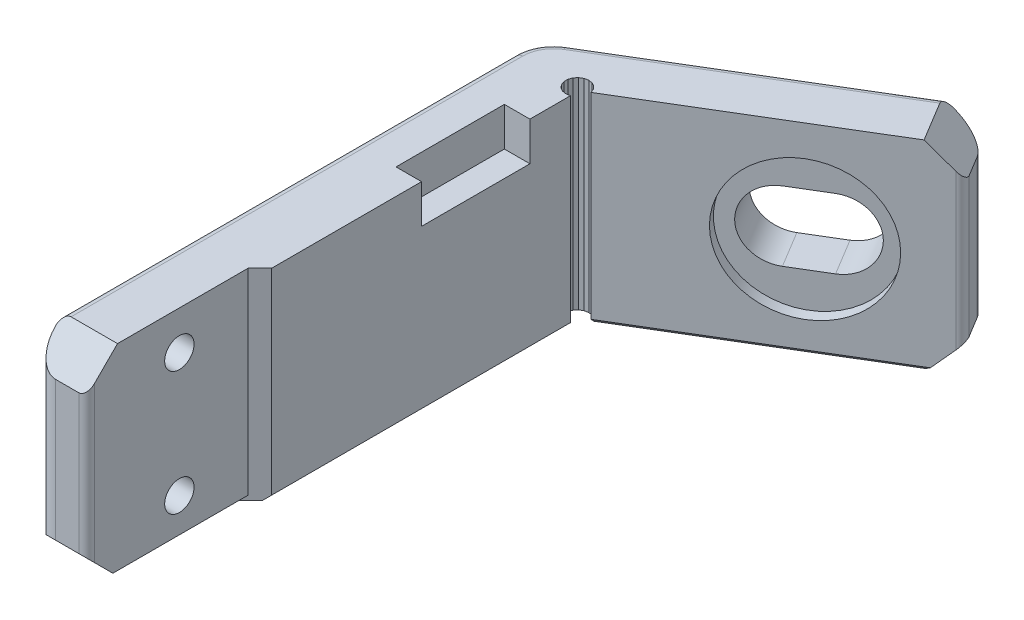
from build123d import *

# Parameters (mm, degrees)
LEG_AND_PAD_DEPTH          = 13
SCREW_HEAD_RELIEF_SKETCH_W = 14
SCREW_HEAD_RELIEF_SKETCH_H = 6
SCREW_HEAD_RELIEF_DEPTH    = 2.35
M6_SLOT_MIDDLE_DEPTH       = 4.5
SCREW_HOLES_SKETCH_R       = 1.9
SCREW_HOLES_DEPTH          = 4.5
LEG_TOP_CORNERS_SIZE       = 4
PAD_END_CORNERS_SIZE       = 4
OUTSIDE_OF_THE_BEND_R      = 5
LEG_TOP_OUTER_EDGE_R       = 3
PAD_END_OUTER_EDGE_R       = 3
LEG_TOP_INNER_EDGE_R       = 1
PAD_END_INNER_EDGE_R       = 1
BED_FACE_CHAMFER_SIZE      = 0.6
TOP_FACE_EDGE_R            = 1


with BuildPart() as part:
    # leg and pad sketch → leg and pad (new, symmetric)
    with BuildSketch(Plane(origin=(0, -20.7, 0), x_dir=(1, 0, 0), z_dir=(0, 1, 0))):
        Polygon((0.551289683, 30.332713936), (0.367250577, 30.819395741), (0.028023026, 31.213926146), (-0.425575667, 31.468833575), (-0.938966578, 31.553446481), (-1.450376329, 31.457583879), (-1.898269923, 31.192780366), (-2.228754897, 30.790898227), (-2.402065893, 30.30029363), (-2.397349395, 29.779998208), (-2.215172912, 29.292616119), (-1.877456693, 28.896791249), (-1.424836191, 28.640150931), (-0.91177263, 28.55357522), (-0.4, 28.647481273), (-0.4, -9.98), (-1.92, -11.5), (-1.92, -32.37), (-8.92, -32.37), (-8.92, 32.792642706), (27.204821487, 54.594667874), (30.821788068, 48.601542416), align=None)
    extrude(amount=LEG_AND_PAD_DEPTH, both=True)

    # screw head relief sketch → screw head relief (cut, symmetric)
    with BuildSketch(Plane(origin=(-1.35, 0, 0), x_dir=(0, 0, -1), z_dir=(1, 0, 0))):
        with Locations((16.4, -9.7)):
            Rectangle(SCREW_HEAD_RELIEF_SKETCH_W, SCREW_HEAD_RELIEF_SKETCH_H)
    extrude(amount=SCREW_HEAD_RELIEF_DEPTH, both=True, mode=Mode.SUBTRACT)

    # insert flange relief sketch → insert flange relief (revolve, cut)
    with BuildSketch(Plane(origin=(0, -20.7, 0), x_dir=(1, 0, 0), z_dir=(0, 1, 0))):
        Polygon((18.324853729, 39.891397061), (17.03307995, 42.03179901), (9.327632933, 37.381413406), (10.619406712, 35.241011457), align=None)
    revolve(axis=Axis((18.324853729, -20.7, -39.891397061), (-0.5167095115681243, 0, -0.8561607796757748)), mode=Mode.SUBTRACT)

    # M6 slot end 1 sketch → M6 slot end 1 (revolve, cut)
    with BuildSketch(Plane(origin=(0, -20.7, 0), x_dir=(1, 0, 0), z_dir=(0, 1, 0))):
        Polygon((20.465255678, 41.18317084), (15.814870074, 48.888617857), (11.962146565, 46.563425055), (16.612532169, 38.857978038), align=None)
    revolve(axis=Axis((20.465255678, -20.7, -41.18317084), (-0.5167095115681236, 0, -0.8561607796757752)), mode=Mode.SUBTRACT)

    # M6 slot end 2 sketch → M6 slot end 2 (revolve, cut)
    with BuildSketch(Plane(origin=(0, -20.7, 0), x_dir=(1, 0, 0), z_dir=(0, 1, 0))):
        Polygon((16.18445178, 38.599623282), (11.534066176, 46.305070299), (7.681342667, 43.979877497), (12.331728271, 36.27443048), align=None)
    revolve(axis=Axis((16.18445178, -20.7, -38.599623282), (-0.5167095115681234, 0, -0.8561607796757752)), mode=Mode.SUBTRACT)

    # M6 slot middle sketch → M6 slot middle (cut, symmetric)
    with BuildSketch(Plane(origin=(0, -20.7, 0), x_dir=(1, 0, 0), z_dir=(0, 1, 0))):
        Polygon((16.18445178, 38.599623282), (20.465255678, 41.18317084), (15.814870074, 48.888617857), (11.534066176, 46.305070299), align=None)
    extrude(amount=M6_SLOT_MIDDLE_DEPTH, both=True, mode=Mode.SUBTRACT)

    # screw holes sketch → screw holes (cut, symmetric)
    with BuildSketch(Plane(origin=(-5.42, 0, 0), x_dir=(0, 0, -1), z_dir=(1, 0, 0))):
        with Locations((-20.375, -28.7)):
            Circle(SCREW_HOLES_SKETCH_R)
        with Locations((-20.375, -12.7)):
            Circle(SCREW_HOLES_SKETCH_R)
    extrude(amount=SCREW_HOLES_DEPTH, both=True, mode=Mode.SUBTRACT)

    # leg top corners
    leg_top_corners_edges = [part.edges().sort_by_distance(p)[0] for p in [
        (-5.42, -7.7, 32.37),
        (-5.42, -33.7, 32.37),
    ]]
    chamfer(leg_top_corners_edges, length=LEG_TOP_CORNERS_SIZE)

    # pad end corners
    pad_end_corners_edges = [part.edges().sort_by_distance(p)[0] for p in [
        (29.013304778, -7.7, -51.598105145),
        (29.013304778, -33.7, -51.598105145),
    ]]
    chamfer(pad_end_corners_edges, length=PAD_END_CORNERS_SIZE)

    # outside of the bend
    outside_of_the_bend_edges = [part.edges().sort_by_distance(p)[0] for p in [
        (-8.92, -20.7, -32.792642706),
    ]]
    fillet(outside_of_the_bend_edges, radius=OUTSIDE_OF_THE_BEND_R)

    # leg top outer edge
    leg_top_outer_edge_edges = [part.edges().sort_by_distance(p)[0] for p in [
        (-8.92, -20.7, 32.37),
    ]]
    fillet(leg_top_outer_edge_edges, radius=LEG_TOP_OUTER_EDGE_R)

    # pad end outer edge
    pad_end_outer_edge_edges = [part.edges().sort_by_distance(p)[0] for p in [
        (27.204821487, -20.7, -54.594667874),
    ]]
    fillet(pad_end_outer_edge_edges, radius=PAD_END_OUTER_EDGE_R)

    # leg top inner edge
    leg_top_inner_edge_edges = [part.edges().sort_by_distance(p)[0] for p in [
        (-1.92, -20.7, 32.37),
    ]]
    fillet(leg_top_inner_edge_edges, radius=LEG_TOP_INNER_EDGE_R)

    # pad end inner edge
    pad_end_inner_edge_edges = [part.edges().sort_by_distance(p)[0] for p in [
        (30.821788068, -20.7, -48.601542416),
    ]]
    fillet(pad_end_inner_edge_edges, radius=PAD_END_INNER_EDGE_R)

    # bed face chamfer
    bed_face_chamfer_edges = [part.edges().sort_by_distance(p)[0] for p in [
        (13.974217317, -33.7, -38.433709153),
        (8.638315405, -33.7, -43.38942405),
        (-1.92, -33.7, 19.935),
        (-0.4, -33.7, -9.333740636),
        (-8.274178326, -33.7, -32.428085628),
        (-8.92, -33.7, -0.800107187),
    ]]
    chamfer(bed_face_chamfer_edges, length=BED_FACE_CHAMFER_SIZE)

    # top face edge
    top_face_edge_edges = [part.edges().sort_by_distance(p)[0] for p in [
        (8.638315405, -7.7, -43.38942405),
        (-8.274178326, -7.7, -32.428085628),
        (-8.92, -7.7, -0.800107187),
    ]]
    fillet(top_face_edge_edges, radius=TOP_FACE_EDGE_R)


solid = part.part
